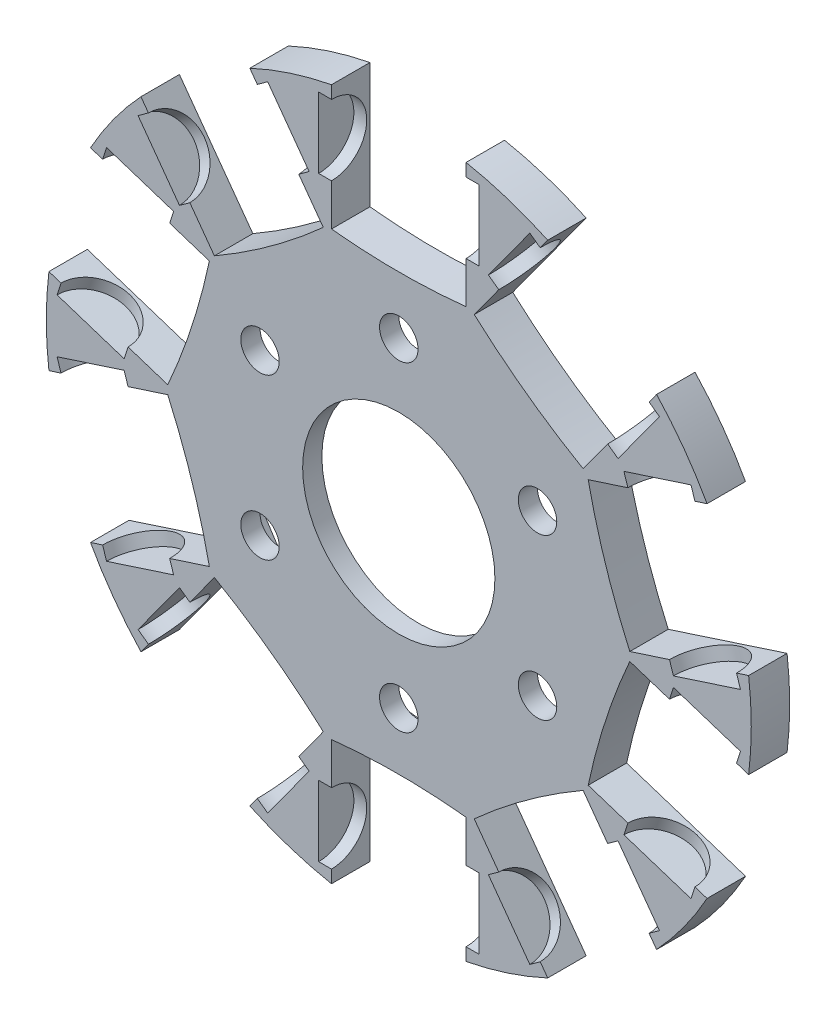
from build123d import *

# Parameters (mm, degrees)
SKETCH2_R           = 1.5
SKETCH2_R_2         = 7.5
BOSS_EXTRUDE2_DEPTH = 3
SKETCH2_4_R         = 15.5
SKETCH2_4_R_2       = 1.5
SKETCH2_4_R_3       = 7.5
BOSS_EXTRUDE3_DEPTH = 3
SKETCH3_W           = 12.5
SKETCH3_H           = 2.75
SKETCH5_R           = 15.5
CUT_EXTRUDE2_DEPTH  = 1.5
CIRPATTERN1_COUNT   = 10


with BuildPart() as part:
    # Sketch2 → Boss-Extrude2 (new body)
    with BuildSketch(Plane.XY):
        with BuildLine():
            Line((-5.25, 17.244212343), (-5.25, 26.994212343))
            ThreePointArc((-5.25, 26.994212343), (-8.497967345, 26.154054198), (-11.619460692, 24.92464911))
            Line((-11.619460692, 24.92464911), (-5.888554482, 17.036733414))
            ThreePointArc((-5.888554482, 17.036733414), (-9.973436378, 13.727257516), (-14.383232923, 10.864988265))
            Line((-14.383232923, 10.864988265), (-20.114139133, 18.75290396))
            ThreePointArc((-20.114139133, 18.75290396), (-22.247967345, 16.164094438), (-24.05068233, 13.334717074))
            Line((-24.05068233, 13.334717074), (-14.777881296, 10.321801379))
            ThreePointArc((-14.777881296, 10.321801379), (-16.137359045, 5.243345799), (-18.022559737, 0.335707958))
            Line((-18.022559737, 0.335707958), (-27.295360771, 3.348623653))
            ThreePointArc((-27.295360771, 3.348623653), (-27.5, 0), (-27.295360771, -3.348623653))
            Line((-27.295360771, -3.348623653), (-18.022559737, -0.335707958))
            ThreePointArc((-18.022559737, -0.335707958), (-16.137359045, -5.243345799), (-14.777881296, -10.321801379))
            Line((-14.777881296, -10.321801379), (-24.05068233, -13.334717074))
            ThreePointArc((-24.05068233, -13.334717074), (-22.247967345, -16.164094438), (-20.114139133, -18.75290396))
            Line((-20.114139133, -18.75290396), (-14.383232923, -10.864988265))
            ThreePointArc((-14.383232923, -10.864988265), (-9.973436378, -13.727257516), (-5.888554482, -17.036733414))
            Line((-5.888554482, -17.036733414), (-11.619460692, -24.92464911))
            ThreePointArc((-11.619460692, -24.92464911), (-8.497967345, -26.154054198), (-5.25, -26.994212343))
            Line((-5.25, -26.994212343), (-5.25, -17.244212343))
            ThreePointArc((-5.25, -17.244212343), (0, -16.967823434), (5.25, -17.244212343))
            Line((5.25, -17.244212343), (5.25, -26.994212343))
            ThreePointArc((5.25, -26.994212343), (8.497967345, -26.154054198), (11.619460692, -24.92464911))
            Line((11.619460692, -24.92464911), (5.888554482, -17.036733414))
            ThreePointArc((5.888554482, -17.036733414), (9.973436378, -13.727257516), (14.383232923, -10.864988265))
            Line((14.383232923, -10.864988265), (20.114139133, -18.75290396))
            ThreePointArc((20.114139133, -18.75290396), (22.247967345, -16.164094438), (24.05068233, -13.334717074))
            Line((24.05068233, -13.334717074), (14.777881296, -10.321801379))
            ThreePointArc((14.777881296, -10.321801379), (16.137359045, -5.243345799), (18.022559737, -0.335707958))
            Line((18.022559737, -0.335707958), (27.295360771, -3.348623653))
            ThreePointArc((27.295360771, -3.348623653), (27.5, 0), (27.295360771, 3.348623653))
            Line((27.295360771, 3.348623653), (18.022559737, 0.335707958))
            ThreePointArc((18.022559737, 0.335707958), (16.137359045, 5.243345799), (14.777881296, 10.321801379))
            Line((14.777881296, 10.321801379), (24.05068233, 13.334717074))
            ThreePointArc((24.05068233, 13.334717074), (22.247967345, 16.164094438), (20.114139133, 18.75290396))
            Line((20.114139133, 18.75290396), (14.383232923, 10.864988265))
            ThreePointArc((14.383232923, 10.864988265), (9.973436378, 13.727257516), (5.888554482, 17.036733414))
            Line((5.888554482, 17.036733414), (11.619460692, 24.92464911))
            ThreePointArc((11.619460692, 24.92464911), (8.497967345, 26.154054198), (5.25, 26.994212343))
            Line((5.25, 26.994212343), (5.25, 17.244212343))
            ThreePointArc((5.25, 17.244212343), (0, 16.967823434), (-5.25, 17.244212343))
        make_face()
        with Locations((0, 12.5)):
            Circle(SKETCH2_R, mode=Mode.SUBTRACT)
        with Locations((-10.825317547, -6.25)):
            Circle(SKETCH2_R, mode=Mode.SUBTRACT)
        with Locations((0, -12.5)):
            Circle(SKETCH2_R, mode=Mode.SUBTRACT)
        with Locations((10.825317547, -6.25)):
            Circle(SKETCH2_R, mode=Mode.SUBTRACT)
        with Locations((-10.825317547, 6.25)):
            Circle(SKETCH2_R, mode=Mode.SUBTRACT)
        Circle(SKETCH2_R_2, mode=Mode.SUBTRACT)
        with Locations((10.825317547, 6.25)):
            Circle(SKETCH2_R, mode=Mode.SUBTRACT)
    extrude(amount=BOSS_EXTRUDE2_DEPTH)

    # Sketch2<4> → Boss-Extrude3 (add)
    with BuildSketch(Plane.XY):
        Circle(SKETCH2_4_R)
        with Locations((-10.825317547, -6.25)):
            Circle(SKETCH2_4_R_2, mode=Mode.SUBTRACT)
        with Locations((0, -12.5)):
            Circle(SKETCH2_4_R_2, mode=Mode.SUBTRACT)
        with Locations((10.825317547, -6.25)):
            Circle(SKETCH2_4_R_2, mode=Mode.SUBTRACT)
        with Locations((-10.825317547, 6.25)):
            Circle(SKETCH2_4_R_2, mode=Mode.SUBTRACT)
        Circle(SKETCH2_4_R_3, mode=Mode.SUBTRACT)
        with Locations((10.825317547, 6.25)):
            Circle(SKETCH2_4_R_2, mode=Mode.SUBTRACT)
        with Locations((0, 12.5)):
            Circle(SKETCH2_4_R_2, mode=Mode.SUBTRACT)
    extrude(amount=BOSS_EXTRUDE3_DEPTH)

    # Sketch3 → Cut-Revolve1 (revolve, cut)
    with BuildSketch(Plane.XY.offset(3)):
        with Locations((0, 24.625)):
            Rectangle(SKETCH3_W, SKETCH3_H)
    cut_revolve1 = revolve(axis=Axis((6.25, 23.25, 3), (-1, 0, 0)), mode=Mode.SUBTRACT)

    # Sketch5 → Cut-Extrude2 (cut)
    with BuildSketch(Plane(origin=(0, 0, 0), x_dir=(-1, 0, 0), z_dir=(0, 0, -1))):
        Circle(SKETCH5_R)
    extrude(amount=-CUT_EXTRUDE2_DEPTH, mode=Mode.SUBTRACT)

    # CirPattern1: Cut-Revolve1 ×10 about axis
    cirpattern1_axis = Axis((0, 0, 3), (0, 0, 1))
    for i in range(1, CIRPATTERN1_COUNT):
        add(cut_revolve1.rotate(cirpattern1_axis, i * 360 / CIRPATTERN1_COUNT), mode=Mode.SUBTRACT)


solid = part.part
